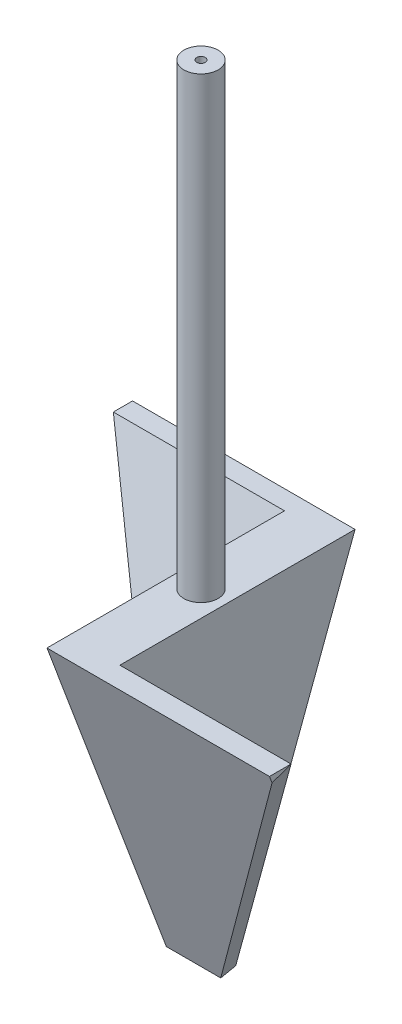
from build123d import *

# Parameters (mm, degrees)
SKETCH_1_R               = 0.5
EXTRUDE_1_DEPTH          = 92
SHELL_1_T                = 1.5
EXTRUDE_2_OUTLINE_R      = 0.5
EXTRUDE_2_DEPTH          = 86
EXTRUDE_4_DEPTH          = 3
EXTRUDE_4_DEPTH_BACK     = 3
CUT_EXTRUDE_1_DEPTH      = 3
CUT_EXTRUDE_1_DEPTH_BACK = 3
CUT_EXTRUDE_2_DEPTH      = 10
CUT_EXTRUDE_2_DEPTH_BACK = 10
EXTRUDE_6_DEPTH          = 20
CUT_EXTRUDE_6_DEPTH      = 15
EXTRUDE_7_DEPTH          = 20
CUT_EXTRUDE_7_DEPTH      = 20


# Read off the part's stored shape, not the designer's step: 凸台-拉伸2
with BuildPart() as part:
    # 草图1 → 凸台-拉伸1 (new body)
    with BuildSketch(Plane(origin=(0, 0, 0), x_dir=(1, 0, 0), z_dir=(0, 1, 0))):
        with Locations(Location((0, 0, 0), (0, 0, 270))):
            Circle(SKETCH_1_R)
    extrude(amount=EXTRUDE_1_DEPTH)

    # 抽壳1
    shell_1_openings = [part.faces().sort_by_distance(p)[0] for p in [
        (0, 92, 0),
    ]]
    offset(amount=SHELL_1_T, openings=shell_1_openings, kind=Kind.INTERSECTION)

    # 凸台-拉伸2 outline → 凸台-拉伸2 (add)
    with BuildSketch(Plane(origin=(0, 0, 0), x_dir=(1, 0, 0), z_dir=(0, 1, 0))):
        Circle(EXTRUDE_2_OUTLINE_R)
    extrude(amount=EXTRUDE_2_DEPTH)

    # 草图5 → 凸台-拉伸4 (add, two sides: drawn at the far end of the back side and taken through both)
    with BuildSketch(Plane(origin=(0, 0, 0), x_dir=(0, 0, -1), z_dir=(1, 0, 0)).offset(-EXTRUDE_4_DEPTH_BACK)):
        Polygon((0, 38.5), (-15, 38.5), (0, -1.5), (15, 38.5), align=None)
    extrude(amount=EXTRUDE_4_DEPTH + EXTRUDE_4_DEPTH_BACK)

    # 草图6 → 切除-拉伸1 (cut, two sides: drawn at the far end of the back side and taken through both)
    with BuildSketch(Plane(origin=(0, 0, 0), x_dir=(0, 0, -1), z_dir=(1, 0, 0)).offset(-CUT_EXTRUDE_1_DEPTH_BACK)):
        Polygon((-2.867091748, -1.5), (0, -1.5), (-2.867091748, 6.145577994), align=None)
        Polygon((0, -1.5), (2.807839657, -1.5), (2.807839657, 5.987572419), align=None)
    extrude(amount=CUT_EXTRUDE_1_DEPTH + CUT_EXTRUDE_1_DEPTH_BACK, mode=Mode.SUBTRACT)

    # 草图8 → 切除-拉伸2 (cut, two sides: drawn at the far end of the back side and taken through both)
    with BuildSketch(Plane(origin=(0, 0, 0), x_dir=(0, 0, -1), z_dir=(1, 0, 0)).offset(-CUT_EXTRUDE_2_DEPTH_BACK)):
        Polygon((0, -1.5), (-1.055736005, 1.315296012), (1.055736005, 1.315296012), align=None)
    extrude(amount=CUT_EXTRUDE_2_DEPTH + CUT_EXTRUDE_2_DEPTH_BACK, mode=Mode.SUBTRACT)

    # 草图12 → 凸台-拉伸6 (add)
    with BuildSketch(Plane(origin=(3, 0, 0), x_dir=(0, 0, -1), z_dir=(1, 0, 0))):
        Polygon((1.055736005, 1.315296012), (-12.479805664, 38.5), (-15, 38.5), (-1.055736005, 1.315296012), align=None)
    extrude(amount=EXTRUDE_6_DEPTH)

    # 草图14 → 切除-拉伸6 (cut)
    with BuildSketch(Plane(origin=(0, 0.49322305, -1.354977403), x_dir=(-1, 0, 0), z_dir=(0, 0.3420517460280193, -0.939681117741111))):
        Polygon((-23, 40.446462351), (-3, 0.874842483), (-23, 0.874842483), align=None)
    extrude(amount=-CUT_EXTRUDE_6_DEPTH, mode=Mode.SUBTRACT)

    # 草图15 → 凸台-拉伸7 (add)
    with BuildSketch(Plane.ZY.offset(3)):
        Polygon((1.055736005, 1.315296012), (-12.756487539, 38.5), (-15, 38.5), (-1.055736005, 1.315296012), align=None)
    extrude(amount=EXTRUDE_7_DEPTH)

    # 草图16 → 切除-拉伸7 (cut)
    with BuildSketch(Plane(origin=(0, 0.504079298, 1.357061695), x_dir=(1, 0, 0), z_dir=(0, 0.3482034119031621, 0.9374190012683746))):
        Polygon((-3, 0.865372595), (-23, 40.532484034), (-23, 0.865372595), align=None)
    extrude(amount=-CUT_EXTRUDE_7_DEPTH, mode=Mode.SUBTRACT)


solid = part.part
